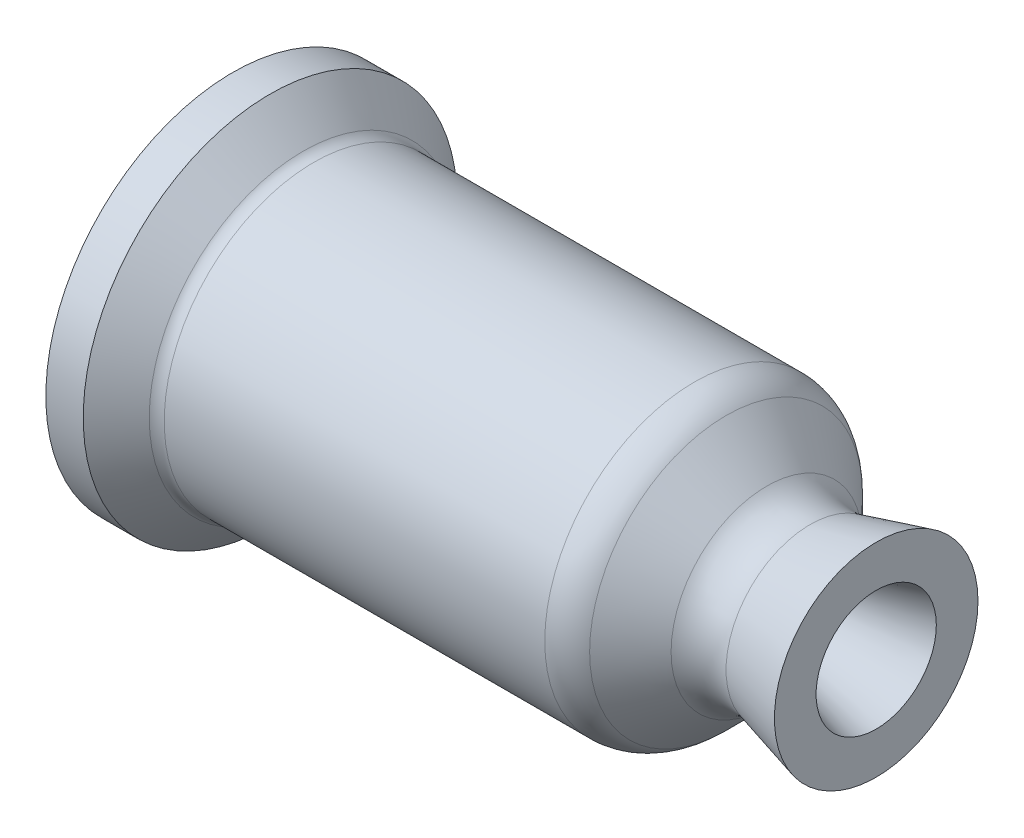
from build123d import *

# Parameters (mm, degrees)
FILLET8_R          = 7.62
FILLET9_R          = 2.54
SKETCH2_R          = 29.765625
SKETCH2_R_2        = 28.178125
CUT_EXTRUDE1_DEPTH = 1.3335


with BuildPart() as part:
    # Sketch1 → Revolve1 (revolve)
    with BuildSketch(Plane.XY):
        Polygon((0, 18.564), (78.7, 18.564), (91.076, 6.188), (94.251, 6.188), (109.257576297, 10.209), (109.257576297, 17.286147969), (93.78995309, 13.141610822), (81.531563912, 25.4), (12.7, 25.4), (6.35, 31.75), (0, 31.75), align=None)
    revolve(axis=Axis((0, 0, 0), (-1, 0, 0)))

    # Fillet8
    fillet8_edges = [part.edges().sort_by_distance(p)[0] for p in [
        (78.7, -18.564, 0),
        (81.531563912, -25.4, 0),
        (93.78995309, -13.141610822, 0),
    ]]
    fillet(fillet8_edges, radius=FILLET8_R)

    # Fillet9
    fillet9_edges = [part.edges().sort_by_distance(p)[0] for p in [
        (12.7, -25.4, 0),
    ]]
    fillet(fillet9_edges, radius=FILLET9_R)

    # Sketch2 → Cut-Extrude1 (cut)
    with BuildSketch(Plane.ZY):
        Circle(SKETCH2_R)
        Circle(SKETCH2_R_2, mode=Mode.SUBTRACT)
    extrude(amount=-CUT_EXTRUDE1_DEPTH, mode=Mode.SUBTRACT)


solid = part.part
